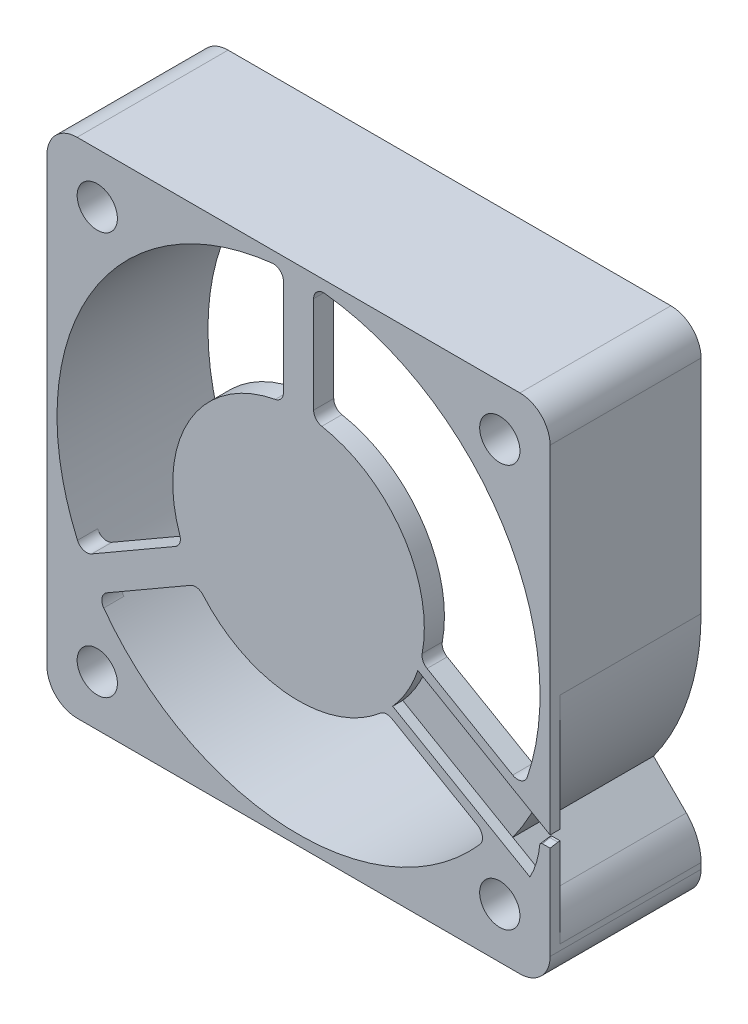
from build123d import *
from build123d.topology import SkipClean

# Parameters (mm, degrees)
SKETCH1_W           = 50
SKETCH1_H           = 50
BOSS_EXTRUDE1_DEPTH = 15
FILLET1_R           = 3
SKETCH3_R           = 24.000000006
CUT_EXTRUDE1_DEPTH  = 13
CUT_EXTRUDE2_START  = -13
CUT_EXTRUDE2_DEPTH  = 13
FILLET2_R           = 1
CUT_EXTRUDE3_START  = -1
CUT_EXTRUDE3_DEPTH  = 1
CHAMFER1_SIZE       = 0.762
CHAMFER1_SIZE2      = 0.134361159
FILLET3_R           = 0.254
SKETCH8_R           = 2
CUT_EXTRUDE5_DEPTH  = 39.405728909
CUT_EXTRUDE6_DEPTH  = 8
CUT_EXTRUDE8_DEPTH  = 14
FILLET5_R           = 5


with BuildPart() as part:
    # Sketch1 → Boss-Extrude1 (new body)
    with BuildSketch(Plane.XY):
        Rectangle(SKETCH1_W, SKETCH1_H)
    extrude(amount=BOSS_EXTRUDE1_DEPTH)

    # Fillet1
    fillet1_edges = [part.edges().sort_by_distance(p)[0] for p in [
        (-25, -25, 7.5),
        (25, -25, 7.5),
        (-25, 25, 7.5),
        (25, 25, 7.5),
    ]]
    fillet(fillet1_edges, radius=FILLET1_R)

    # Sketch3 → Cut-Extrude1 (cut)
    with BuildSketch(Plane.XY):
        Circle(SKETCH3_R)
    extrude(amount=CUT_EXTRUDE1_DEPTH, mode=Mode.SUBTRACT)

    # Sketch4 → Cut-Extrude2 (cut)
    with SkipClean():  # the faces are left unmerged after this step: merging them gives an invalid solid
        with BuildSketch(Plane.XY.offset(15).offset(CUT_EXTRUDE2_START)):
            with BuildLine():
                Line((-21.493975029, -10.677501461), (-11.49709263, -4.905798717))
                ThreePointArc((-11.49709263, -4.905798717), (-10.825317547, 6.25), (-1.5, 12.409673646))
                Line((-1.5, 12.409673646), (-1.5, 23.953079134))
                ThreePointArc((-1.5, 23.953079134), (-20.784609691, 12), (-21.493975029, -10.677501461))
            make_face()
            with BuildLine():
                ThreePointArc((8.642304845, -9.031088913), (-1.020763501, -12.458251959), (-9.99709263, -7.503874929))
                Line((-9.99709263, -7.503874929), (-19.993975029, -13.275577673))
                ThreePointArc((-19.993975029, -13.275577673), (-1.005479599, -23.978928474), (18.812405015, -14.902798984))
                Line((18.812405015, -14.902798984), (8.642304845, -9.031088913))
            make_face()
            with BuildLine():
                Line((1.5, 23.953079134), (1.5, 12.409673646))
                ThreePointArc((1.5, 12.409673646), (10.278780933, 7.113133102), (12.142304845, -2.968911087))
                Line((12.142304845, -2.968911087), (22.312405015, -8.840621157))
                ThreePointArc((22.312405015, -8.840621157), (20.263621415, 12.860235113), (1.5, 23.953079134))
            make_face()
        extrude(amount=CUT_EXTRUDE2_DEPTH, mode=Mode.SUBTRACT)

    # Fillet2
    fillet2_edges = [part.edges().sort_by_distance(p)[0] for p in [
        (-19.993975029, -13.275577673, 14),
        (-21.493975029, -10.677501461, 14),
        (-11.49709263, -4.905798717, 14),
        (-9.99709263, -7.503874929, 14),
        (-1.5, 23.953079134, 14),
        (1.5, 23.953079134, 14),
        (1.5, 12.409673646, 14),
        (-1.5, 12.409673646, 14),
        (18.812405015, -14.902798984, 14),
        (22.312405015, -8.840621157, 14),
        (8.642304845, -9.031088913, 14),
        (12.142304845, -2.968911087, 14),
    ]]
    fillet(fillet2_edges, radius=FILLET2_R)

    # Sketch5 → Cut-Extrude3 (cut)
    with BuildSketch(Plane.XY.offset(15).offset(CUT_EXTRUDE3_START)):
        with BuildLine():
            Line((25, -11.547005384), (11.856601718, -3.958660847))
            ThreePointArc((11.856601718, -3.958660847), (10.825317547, -6.25), (9.356601718, -8.288787866))
            Line((9.356601718, -8.288787866), (23, -16.165807537))
            ThreePointArc((23, -16.165807537), (23.695077997, -14.410313248), (24, -12.547005384))
            Line((24, -12.547005384), (25, -12.547005384))
            Line((25, -12.547005384), (25, -11.547005384))
        make_face()
    extrude(amount=CUT_EXTRUDE3_DEPTH, mode=Mode.SUBTRACT)

    # Chamfer1
    chamfer1_edges = [part.edges().sort_by_distance(p)[0] for p in [
        (24.5, -12.547005384, 15),
    ]]
    chamfer1_side = [part.faces().sort_by_distance(p)[0] for p in [
        (24.5, -12.547005384, 14.5),
    ]]
    chamfer(chamfer1_edges, length=CHAMFER1_SIZE, length2=CHAMFER1_SIZE2, reference=chamfer1_side[0])

    # Fillet3
    fillet3_edges = [part.edges().sort_by_distance(p)[0] for p in [
        (24, -12.547005384, 14.119),
        (23.996056677, -12.614186449, 14.619002756),
    ]]
    fillet(fillet3_edges, radius=FILLET3_R)

    # Sketch8 → Cut-Extrude5 (cut, through all)
    with BuildSketch(Plane.XY.offset(15)):
        with Locations((20, 20)):
            Circle(SKETCH8_R)
        with Locations((-20, 20)):
            Circle(SKETCH8_R)
        with Locations((-20, -20)):
            Circle(SKETCH8_R)
        with Locations((20, -20)):
            Circle(SKETCH8_R)
    extrude(amount=-CUT_EXTRUDE5_DEPTH, mode=Mode.SUBTRACT)

    # Sketch9 → Cut-Extrude6 (cut)
    with BuildSketch(Plane(origin=(0, 0, 0), x_dir=(-1, 0, 0), z_dir=(0, 0, -1))):
        with BuildLine():
            ThreePointArc((7, 24), (10.969730555, 22.464750423), (14.621501242, 20.278355491))
            Line((14.621501242, 20.278355491), (18.343145751, 24))
            Line((18.343145751, 24), (7, 24))
        make_face()
        with BuildLine():
            Line((24, 18.343145751), (20.278355491, 14.621501242))
            ThreePointArc((20.278355491, 14.621501242), (22.464750423, 10.969730555), (24, 7))
            Line((24, 7), (24, 18.343145751))
        make_face()
        with BuildLine():
            ThreePointArc((-14.942831819, 20.042748744), (-11.148404659, 22.376618904), (-7, 24))
            Line((-7, 24), (-18.418733481, 24))
            Line((-18.418733481, 24), (-14.942831819, 20.042748744))
        make_face()
        with BuildLine():
            Line((24, -18.343145751), (24, -7))
            ThreePointArc((24, -7), (22.464750423, -10.969730555), (20.278355491, -14.621501242))
            Line((20.278355491, -14.621501242), (24, -18.343145751))
        make_face()
        with BuildLine():
            ThreePointArc((-24, 7), (-22.557225572, 10.778291818), (-20.524098338, 14.274501302))
            Line((-20.524098338, 14.274501302), (-24, 18.231752558))
            Line((-24, 18.231752558), (-24, 7))
        make_face()
        with BuildLine():
            Line((18.343145751, -24), (14.621501242, -20.278355491))
            ThreePointArc((14.621501242, -20.278355491), (10.969730555, -22.464750423), (7, -24))
            Line((7, -24), (18.343145751, -24))
        make_face()
        with BuildLine():
            Line((-18.343145751, -24), (-7, -24))
            ThreePointArc((-7, -24), (-10.969730555, -22.464750423), (-14.621501242, -20.278355491))
            Line((-14.621501242, -20.278355491), (-18.343145751, -24))
        make_face()
    extrude(amount=-CUT_EXTRUDE6_DEPTH, mode=Mode.SUBTRACT)

    # Sketch9<4> → Cut-Extrude8 (cut)
    with BuildSketch(Plane(origin=(0, 0, 0), x_dir=(-1, 0, 0), z_dir=(0, 0, -1))):
        with BuildLine():
            ThreePointArc((-20.278355491, -14.621501242), (-23.790322479, -7.682483736), (-25, 0))
            Line((-25, 0), (-25, -19.343145751))
            Line((-25, -19.343145751), (-20.278355491, -14.621501242))
        make_face()
    extrude(amount=-CUT_EXTRUDE8_DEPTH, mode=Mode.SUBTRACT)

    # Fillet5
    fillet5_edges = [part.edges().sort_by_distance(p)[0] for p in [
        (25, -19.343145751, 7),
    ]]
    fillet(fillet5_edges, radius=FILLET5_R)


solid = part.part
